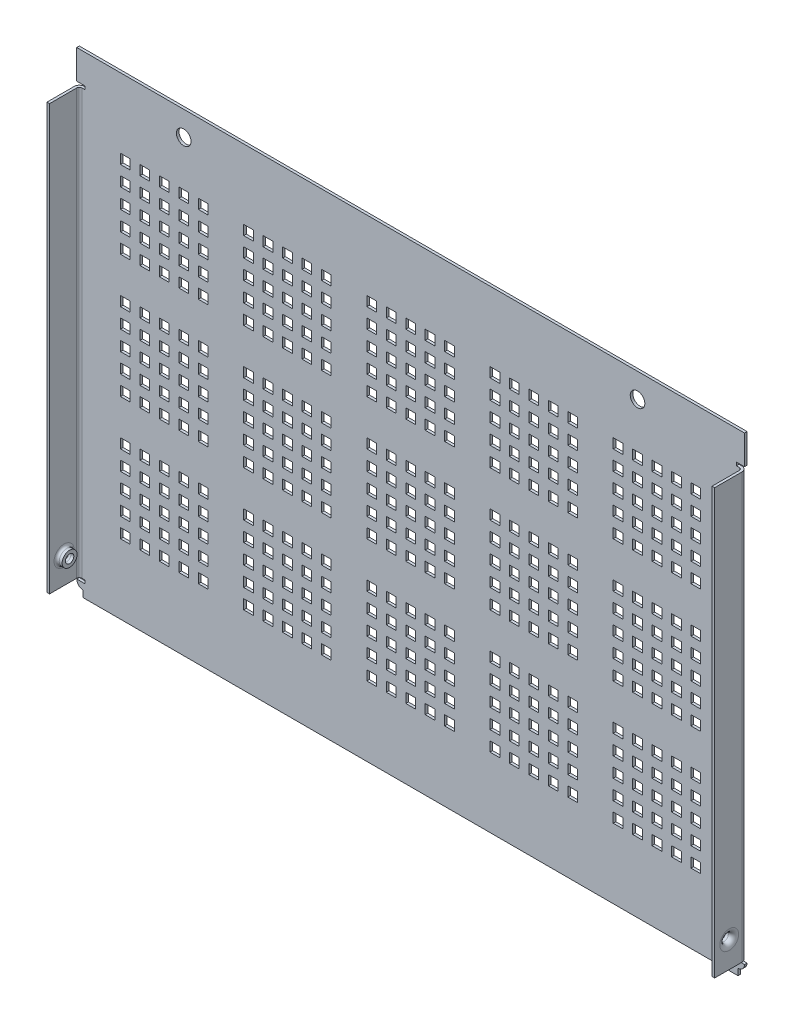
from build123d import *

# Parameters (mm, degrees)
SKETCH_1_R                       = 2.25
EXTRUDE_1_DEPTH                  = 0.8
SKETCH_2_W                       = 0.8
SKETCH_2_H                       = 131
EXTRUDE_2_DEPTH                  = 9.2
SKETCH_3_W                       = 4.088391851
SKETCH_3_H                       = 1
CUT_EXTRUDE_1_DEPTH              = 5
FILLET_1_R                       = 0.8
FILLET_2_R                       = 1.6
SKETCH_4_R                       = 2.3
EXTRUDE_3_DEPTH                  = 2.5
SKETCH_5_R                       = 1.3
CUT_EXTRUDE_2_DEPTH              = 300
FILLET_3_R                       = 1.6
FILLET_4_R                       = 0.8
EXTRUDE_START                    = -2.5
SKETCH_6_R                       = 2.3
SKETCH_6_R_2                     = 1.3
EXTRUDE_4_DEPTH                  = 2.5
FILLET_5_R                       = 0.8
FILLET_6_R                       = 1.6
SKETCH_7_W                       = 3
SKETCH_7_H                       = 3
CUT_EXTRUDE_3_DEPTH              = 10
PATTERN_LINEAR_1_COUNT           = 3
PATTERN_LINEAR_1_PITCH           = 38
PATTERN_LINEAR_3_COUNT           = 3
PATTERN_LINEAR_3_PITCH           = 38
PATTERN_LINEAR_4_COUNT           = 2
PATTERN_LINEAR_4_PITCH           = 38
PATTERN_LINEAR_4_COPY_1_SKETCH_W = 3
PATTERN_LINEAR_4_COPY_1_SKETCH_H = 3
PATTERN_LINEAR_4_COPY_1_DEPTH    = 10
PATTERN_LINEAR_4_COPY_2_SKETCH_W = 3
PATTERN_LINEAR_4_COPY_2_SKETCH_H = 3
PATTERN_LINEAR_4_COPY_2_DEPTH    = 10
PATTERN_LINEAR_4_COPY_3_SKETCH_W = 3
PATTERN_LINEAR_4_COPY_3_SKETCH_H = 3
PATTERN_LINEAR_4_COPY_3_DEPTH    = 10
PATTERN_LINEAR_4_COPY_4_SKETCH_W = 3
PATTERN_LINEAR_4_COPY_4_SKETCH_H = 3
PATTERN_LINEAR_4_COPY_4_DEPTH    = 10
PATTERN_LINEAR_5_COUNT           = 2
PATTERN_LINEAR_5_PITCH           = 38
PATTERN_LINEAR_5_COPY_1_SKETCH_W = 3
PATTERN_LINEAR_5_COPY_1_SKETCH_H = 3
PATTERN_LINEAR_5_COPY_1_DEPTH    = 10
PATTERN_LINEAR_5_COPY_2_SKETCH_W = 3
PATTERN_LINEAR_5_COPY_2_SKETCH_H = 3
PATTERN_LINEAR_5_COPY_2_DEPTH    = 10
PATTERN_LINEAR_5_COPY_3_SKETCH_W = 3
PATTERN_LINEAR_5_COPY_3_SKETCH_H = 3
PATTERN_LINEAR_5_COPY_3_DEPTH    = 10
PATTERN_LINEAR_5_COPY_4_SKETCH_W = 3
PATTERN_LINEAR_5_COPY_4_SKETCH_H = 3
PATTERN_LINEAR_5_COPY_4_DEPTH    = 10


with BuildPart() as part:
    # Эскиз1 → Вытянуть1 (new body)
    with BuildSketch(Plane.XY):
        with BuildLine():
            Line((-101, -73), (101, -73))
            Line((101, -73), (101, -71))
            ThreePointArc((101, -71), (102.414213562, -70.414213562), (103, -69))
            Line((103, -69), (103, 73))
            Line((103, 73), (-103, 73))
            Line((-103, 73), (-103, -69))
            ThreePointArc((-103, -69), (-102.414213562, -70.414213562), (-101, -71))
            Line((-101, -71), (-101, -73))
        make_face()
        with Locations((-70, 65.5)):
            Circle(SKETCH_1_R, mode=Mode.SUBTRACT)
        with Locations((70, 65.5)):
            Circle(SKETCH_1_R, mode=Mode.SUBTRACT)
    extrude(amount=EXTRUDE_1_DEPTH)

    # Эскиз2 → Вытянуть2 (add)
    with BuildSketch(Plane.XY.offset(0.8)):
        with Locations((-102.6, -2.5)):
            Rectangle(SKETCH_2_W, SKETCH_2_H)
        with Locations((102.6, -2.5)):
            Rectangle(SKETCH_2_W, SKETCH_2_H)
    extrude(amount=EXTRUDE_2_DEPTH)

    # Эскиз3 → Вырез-Вытянуть1 (cut)
    with BuildSketch(Plane.XY.offset(0.8)):
        with Locations((-102.544195926, 63.5)):
            Rectangle(SKETCH_3_W, SKETCH_3_H)
        with Locations((-102.544195926, -68.5)):
            Rectangle(SKETCH_3_W, SKETCH_3_H)
        with Locations((102.544195926, -68.5)):
            Rectangle(SKETCH_3_W, SKETCH_3_H)
        with Locations((102.544195926, 63.5)):
            Rectangle(SKETCH_3_W, SKETCH_3_H)
    extrude(amount=-CUT_EXTRUDE_1_DEPTH, mode=Mode.SUBTRACT)

    # Скругление1
    fillet_1_edges = [part.edges().sort_by_distance(p)[0] for p in [
        (102.2, -2.5, 0.8),
        (-102.2, -2.5, 0.8),
    ]]
    fillet(fillet_1_edges, radius=FILLET_1_R)

    # Скругление2
    fillet_2_edges = [part.edges().sort_by_distance(p)[0] for p in [
        (-103, -2.5, 0),
        (103, -2.5, 0),
    ]]
    fillet(fillet_2_edges, radius=FILLET_2_R)

    # Эскиз4 → Вытянуть3 (add)
    with BuildSketch(Plane.ZY.offset(103)):
        with Locations(Location((5.5, -60, 0), (0, 0, 270))):
            Circle(SKETCH_4_R)
    extrude(amount=-EXTRUDE_3_DEPTH)

    # Эскиз5 → Вырез-Вытянуть2 (cut)
    with BuildSketch(Plane.ZY.offset(103)):
        with Locations(Location((5.5, -60, 0), (0, 0, 270))):
            Circle(SKETCH_5_R)
    extrude(amount=-CUT_EXTRUDE_2_DEPTH, mode=Mode.SUBTRACT)

    # Скругление3
    fillet_3_edges = [part.edges().sort_by_distance(p)[0] for p in [
        (-103, -58.7, 5.5),
    ]]
    fillet(fillet_3_edges, radius=FILLET_3_R)

    # Скругление4
    fillet_4_edges = [part.edges().sort_by_distance(p)[0] for p in [
        (-102.2, -57.7, 5.5),
    ]]
    fillet(fillet_4_edges, radius=FILLET_4_R)

    # Эскиз6 → Вытянуть4 (add)
    with BuildSketch(Plane(origin=(103, 0, 0), x_dir=(0, 0, -1), z_dir=(1, 0, 0)).offset(EXTRUDE_START)):
        with Locations(Location((-5.5, -60, 0), (0, 0, 270))):
            Circle(SKETCH_6_R)
        with Locations(Location((-5.5, -60, 0), (0, 0, 270))):
            Circle(SKETCH_6_R_2, mode=Mode.SUBTRACT)
    extrude(amount=EXTRUDE_4_DEPTH)

    # Скругление5
    fillet_5_edges = [part.edges().sort_by_distance(p)[0] for p in [
        (102.2, -57.7, 5.5),
    ]]
    fillet(fillet_5_edges, radius=FILLET_5_R)

    # Скругление6
    fillet_6_edges = [part.edges().sort_by_distance(p)[0] for p in [
        (103, -58.7, 5.5),
    ]]
    fillet(fillet_6_edges, radius=FILLET_6_R)

    # Эскиз7 → Вырез-Вытянуть3 (cut)
    with BuildSketch(Plane(origin=(0, 0, 0), x_dir=(-1, 0, 0), z_dir=(0, 0, -1))):
        with Locations((6, 0)):
            Rectangle(SKETCH_7_W, SKETCH_7_H)
        Rectangle(SKETCH_7_W, SKETCH_7_H)
        with Locations((12, 0)):
            Rectangle(SKETCH_7_W, SKETCH_7_H)
        with Locations((-6, 0)):
            Rectangle(SKETCH_7_W, SKETCH_7_H)
        with Locations((-12, 0)):
            Rectangle(SKETCH_7_W, SKETCH_7_H)
        with Locations((6, 6)):
            Rectangle(SKETCH_7_W, SKETCH_7_H)
        with Locations((0, 6)):
            Rectangle(SKETCH_7_W, SKETCH_7_H)
        with Locations((12, 6)):
            Rectangle(SKETCH_7_W, SKETCH_7_H)
        with Locations((-6, 6)):
            Rectangle(SKETCH_7_W, SKETCH_7_H)
        with Locations((-12, 6)):
            Rectangle(SKETCH_7_W, SKETCH_7_H)
        with Locations((6, 12)):
            Rectangle(SKETCH_7_W, SKETCH_7_H)
        with Locations((0, 12)):
            Rectangle(SKETCH_7_W, SKETCH_7_H)
        with Locations((12, 12)):
            Rectangle(SKETCH_7_W, SKETCH_7_H)
        with Locations((-6, 12)):
            Rectangle(SKETCH_7_W, SKETCH_7_H)
        with Locations((-12, 12)):
            Rectangle(SKETCH_7_W, SKETCH_7_H)
        with Locations((6, -6)):
            Rectangle(SKETCH_7_W, SKETCH_7_H)
        with Locations((0, -6)):
            Rectangle(SKETCH_7_W, SKETCH_7_H)
        with Locations((12, -6)):
            Rectangle(SKETCH_7_W, SKETCH_7_H)
        with Locations((-6, -6)):
            Rectangle(SKETCH_7_W, SKETCH_7_H)
        with Locations((-12, -6)):
            Rectangle(SKETCH_7_W, SKETCH_7_H)
        with Locations((6, -12)):
            Rectangle(SKETCH_7_W, SKETCH_7_H)
        with Locations((0, -12)):
            Rectangle(SKETCH_7_W, SKETCH_7_H)
        with Locations((12, -12)):
            Rectangle(SKETCH_7_W, SKETCH_7_H)
        with Locations((-6, -12)):
            Rectangle(SKETCH_7_W, SKETCH_7_H)
        with Locations((-12, -12)):
            Rectangle(SKETCH_7_W, SKETCH_7_H)
    cut_extrude_3 = extrude(amount=-CUT_EXTRUDE_3_DEPTH, mode=Mode.SUBTRACT)

    # Линейный массив1: Вырез-Вытянуть3 ×3
    with Locations(*[(-i * PATTERN_LINEAR_1_PITCH, 0, 0) for i in range(1, PATTERN_LINEAR_1_COUNT)]):
        add(cut_extrude_3, mode=Mode.SUBTRACT)

    # Линейный массив3: Вырез-Вытянуть3 ×3
    with Locations(*[(i * PATTERN_LINEAR_3_PITCH, 0, 0) for i in range(1, PATTERN_LINEAR_3_COUNT)]):
        add(cut_extrude_3, mode=Mode.SUBTRACT)

    # Линейный массив4: Вырез-Вытянуть3 ×2
    with Locations(*[(0, i * PATTERN_LINEAR_4_PITCH, 0) for i in range(1, PATTERN_LINEAR_4_COUNT)]):
        add(cut_extrude_3, mode=Mode.SUBTRACT)

    # Линейный массив4 copy 1 sketch → Линейный массив4 copy 1 (cut)
    with BuildSketch(Plane(origin=(-38, 38, 0), x_dir=(-1, 0, 0), z_dir=(0, 0, -1))):
        with Locations((6, 0)):
            Rectangle(PATTERN_LINEAR_4_COPY_1_SKETCH_W, PATTERN_LINEAR_4_COPY_1_SKETCH_H)
        Rectangle(PATTERN_LINEAR_4_COPY_1_SKETCH_W, PATTERN_LINEAR_4_COPY_1_SKETCH_H)
        with Locations((12, 0)):
            Rectangle(PATTERN_LINEAR_4_COPY_1_SKETCH_W, PATTERN_LINEAR_4_COPY_1_SKETCH_H)
        with Locations((-6, 0)):
            Rectangle(PATTERN_LINEAR_4_COPY_1_SKETCH_W, PATTERN_LINEAR_4_COPY_1_SKETCH_H)
        with Locations((-12, 0)):
            Rectangle(PATTERN_LINEAR_4_COPY_1_SKETCH_W, PATTERN_LINEAR_4_COPY_1_SKETCH_H)
        with Locations((6, 6)):
            Rectangle(PATTERN_LINEAR_4_COPY_1_SKETCH_W, PATTERN_LINEAR_4_COPY_1_SKETCH_H)
        with Locations((0, 6)):
            Rectangle(PATTERN_LINEAR_4_COPY_1_SKETCH_W, PATTERN_LINEAR_4_COPY_1_SKETCH_H)
        with Locations((12, 6)):
            Rectangle(PATTERN_LINEAR_4_COPY_1_SKETCH_W, PATTERN_LINEAR_4_COPY_1_SKETCH_H)
        with Locations((-6, 6)):
            Rectangle(PATTERN_LINEAR_4_COPY_1_SKETCH_W, PATTERN_LINEAR_4_COPY_1_SKETCH_H)
        with Locations((-12, 6)):
            Rectangle(PATTERN_LINEAR_4_COPY_1_SKETCH_W, PATTERN_LINEAR_4_COPY_1_SKETCH_H)
        with Locations((6, 12)):
            Rectangle(PATTERN_LINEAR_4_COPY_1_SKETCH_W, PATTERN_LINEAR_4_COPY_1_SKETCH_H)
        with Locations((0, 12)):
            Rectangle(PATTERN_LINEAR_4_COPY_1_SKETCH_W, PATTERN_LINEAR_4_COPY_1_SKETCH_H)
        with Locations((12, 12)):
            Rectangle(PATTERN_LINEAR_4_COPY_1_SKETCH_W, PATTERN_LINEAR_4_COPY_1_SKETCH_H)
        with Locations((-6, 12)):
            Rectangle(PATTERN_LINEAR_4_COPY_1_SKETCH_W, PATTERN_LINEAR_4_COPY_1_SKETCH_H)
        with Locations((-12, 12)):
            Rectangle(PATTERN_LINEAR_4_COPY_1_SKETCH_W, PATTERN_LINEAR_4_COPY_1_SKETCH_H)
        with Locations((6, -6)):
            Rectangle(PATTERN_LINEAR_4_COPY_1_SKETCH_W, PATTERN_LINEAR_4_COPY_1_SKETCH_H)
        with Locations((0, -6)):
            Rectangle(PATTERN_LINEAR_4_COPY_1_SKETCH_W, PATTERN_LINEAR_4_COPY_1_SKETCH_H)
        with Locations((12, -6)):
            Rectangle(PATTERN_LINEAR_4_COPY_1_SKETCH_W, PATTERN_LINEAR_4_COPY_1_SKETCH_H)
        with Locations((-6, -6)):
            Rectangle(PATTERN_LINEAR_4_COPY_1_SKETCH_W, PATTERN_LINEAR_4_COPY_1_SKETCH_H)
        with Locations((-12, -6)):
            Rectangle(PATTERN_LINEAR_4_COPY_1_SKETCH_W, PATTERN_LINEAR_4_COPY_1_SKETCH_H)
        with Locations((6, -12)):
            Rectangle(PATTERN_LINEAR_4_COPY_1_SKETCH_W, PATTERN_LINEAR_4_COPY_1_SKETCH_H)
        with Locations((0, -12)):
            Rectangle(PATTERN_LINEAR_4_COPY_1_SKETCH_W, PATTERN_LINEAR_4_COPY_1_SKETCH_H)
        with Locations((12, -12)):
            Rectangle(PATTERN_LINEAR_4_COPY_1_SKETCH_W, PATTERN_LINEAR_4_COPY_1_SKETCH_H)
        with Locations((-6, -12)):
            Rectangle(PATTERN_LINEAR_4_COPY_1_SKETCH_W, PATTERN_LINEAR_4_COPY_1_SKETCH_H)
        with Locations((-12, -12)):
            Rectangle(PATTERN_LINEAR_4_COPY_1_SKETCH_W, PATTERN_LINEAR_4_COPY_1_SKETCH_H)
    extrude(amount=-PATTERN_LINEAR_4_COPY_1_DEPTH, mode=Mode.SUBTRACT)

    # Линейный массив4 copy 2 sketch → Линейный массив4 copy 2 (cut)
    with BuildSketch(Plane(origin=(-76, 38, 0), x_dir=(-1, 0, 0), z_dir=(0, 0, -1))):
        with Locations((6, 0)):
            Rectangle(PATTERN_LINEAR_4_COPY_2_SKETCH_W, PATTERN_LINEAR_4_COPY_2_SKETCH_H)
        Rectangle(PATTERN_LINEAR_4_COPY_2_SKETCH_W, PATTERN_LINEAR_4_COPY_2_SKETCH_H)
        with Locations((12, 0)):
            Rectangle(PATTERN_LINEAR_4_COPY_2_SKETCH_W, PATTERN_LINEAR_4_COPY_2_SKETCH_H)
        with Locations((-6, 0)):
            Rectangle(PATTERN_LINEAR_4_COPY_2_SKETCH_W, PATTERN_LINEAR_4_COPY_2_SKETCH_H)
        with Locations((-12, 0)):
            Rectangle(PATTERN_LINEAR_4_COPY_2_SKETCH_W, PATTERN_LINEAR_4_COPY_2_SKETCH_H)
        with Locations((6, 6)):
            Rectangle(PATTERN_LINEAR_4_COPY_2_SKETCH_W, PATTERN_LINEAR_4_COPY_2_SKETCH_H)
        with Locations((0, 6)):
            Rectangle(PATTERN_LINEAR_4_COPY_2_SKETCH_W, PATTERN_LINEAR_4_COPY_2_SKETCH_H)
        with Locations((12, 6)):
            Rectangle(PATTERN_LINEAR_4_COPY_2_SKETCH_W, PATTERN_LINEAR_4_COPY_2_SKETCH_H)
        with Locations((-6, 6)):
            Rectangle(PATTERN_LINEAR_4_COPY_2_SKETCH_W, PATTERN_LINEAR_4_COPY_2_SKETCH_H)
        with Locations((-12, 6)):
            Rectangle(PATTERN_LINEAR_4_COPY_2_SKETCH_W, PATTERN_LINEAR_4_COPY_2_SKETCH_H)
        with Locations((6, 12)):
            Rectangle(PATTERN_LINEAR_4_COPY_2_SKETCH_W, PATTERN_LINEAR_4_COPY_2_SKETCH_H)
        with Locations((0, 12)):
            Rectangle(PATTERN_LINEAR_4_COPY_2_SKETCH_W, PATTERN_LINEAR_4_COPY_2_SKETCH_H)
        with Locations((12, 12)):
            Rectangle(PATTERN_LINEAR_4_COPY_2_SKETCH_W, PATTERN_LINEAR_4_COPY_2_SKETCH_H)
        with Locations((-6, 12)):
            Rectangle(PATTERN_LINEAR_4_COPY_2_SKETCH_W, PATTERN_LINEAR_4_COPY_2_SKETCH_H)
        with Locations((-12, 12)):
            Rectangle(PATTERN_LINEAR_4_COPY_2_SKETCH_W, PATTERN_LINEAR_4_COPY_2_SKETCH_H)
        with Locations((6, -6)):
            Rectangle(PATTERN_LINEAR_4_COPY_2_SKETCH_W, PATTERN_LINEAR_4_COPY_2_SKETCH_H)
        with Locations((0, -6)):
            Rectangle(PATTERN_LINEAR_4_COPY_2_SKETCH_W, PATTERN_LINEAR_4_COPY_2_SKETCH_H)
        with Locations((12, -6)):
            Rectangle(PATTERN_LINEAR_4_COPY_2_SKETCH_W, PATTERN_LINEAR_4_COPY_2_SKETCH_H)
        with Locations((-6, -6)):
            Rectangle(PATTERN_LINEAR_4_COPY_2_SKETCH_W, PATTERN_LINEAR_4_COPY_2_SKETCH_H)
        with Locations((-12, -6)):
            Rectangle(PATTERN_LINEAR_4_COPY_2_SKETCH_W, PATTERN_LINEAR_4_COPY_2_SKETCH_H)
        with Locations((6, -12)):
            Rectangle(PATTERN_LINEAR_4_COPY_2_SKETCH_W, PATTERN_LINEAR_4_COPY_2_SKETCH_H)
        with Locations((0, -12)):
            Rectangle(PATTERN_LINEAR_4_COPY_2_SKETCH_W, PATTERN_LINEAR_4_COPY_2_SKETCH_H)
        with Locations((12, -12)):
            Rectangle(PATTERN_LINEAR_4_COPY_2_SKETCH_W, PATTERN_LINEAR_4_COPY_2_SKETCH_H)
        with Locations((-6, -12)):
            Rectangle(PATTERN_LINEAR_4_COPY_2_SKETCH_W, PATTERN_LINEAR_4_COPY_2_SKETCH_H)
        with Locations((-12, -12)):
            Rectangle(PATTERN_LINEAR_4_COPY_2_SKETCH_W, PATTERN_LINEAR_4_COPY_2_SKETCH_H)
    extrude(amount=-PATTERN_LINEAR_4_COPY_2_DEPTH, mode=Mode.SUBTRACT)

    # Линейный массив4 copy 3 sketch → Линейный массив4 copy 3 (cut)
    with BuildSketch(Plane(origin=(38, 38, 0), x_dir=(-1, 0, 0), z_dir=(0, 0, -1))):
        with Locations((6, 0)):
            Rectangle(PATTERN_LINEAR_4_COPY_3_SKETCH_W, PATTERN_LINEAR_4_COPY_3_SKETCH_H)
        Rectangle(PATTERN_LINEAR_4_COPY_3_SKETCH_W, PATTERN_LINEAR_4_COPY_3_SKETCH_H)
        with Locations((12, 0)):
            Rectangle(PATTERN_LINEAR_4_COPY_3_SKETCH_W, PATTERN_LINEAR_4_COPY_3_SKETCH_H)
        with Locations((-6, 0)):
            Rectangle(PATTERN_LINEAR_4_COPY_3_SKETCH_W, PATTERN_LINEAR_4_COPY_3_SKETCH_H)
        with Locations((-12, 0)):
            Rectangle(PATTERN_LINEAR_4_COPY_3_SKETCH_W, PATTERN_LINEAR_4_COPY_3_SKETCH_H)
        with Locations((6, 6)):
            Rectangle(PATTERN_LINEAR_4_COPY_3_SKETCH_W, PATTERN_LINEAR_4_COPY_3_SKETCH_H)
        with Locations((0, 6)):
            Rectangle(PATTERN_LINEAR_4_COPY_3_SKETCH_W, PATTERN_LINEAR_4_COPY_3_SKETCH_H)
        with Locations((12, 6)):
            Rectangle(PATTERN_LINEAR_4_COPY_3_SKETCH_W, PATTERN_LINEAR_4_COPY_3_SKETCH_H)
        with Locations((-6, 6)):
            Rectangle(PATTERN_LINEAR_4_COPY_3_SKETCH_W, PATTERN_LINEAR_4_COPY_3_SKETCH_H)
        with Locations((-12, 6)):
            Rectangle(PATTERN_LINEAR_4_COPY_3_SKETCH_W, PATTERN_LINEAR_4_COPY_3_SKETCH_H)
        with Locations((6, 12)):
            Rectangle(PATTERN_LINEAR_4_COPY_3_SKETCH_W, PATTERN_LINEAR_4_COPY_3_SKETCH_H)
        with Locations((0, 12)):
            Rectangle(PATTERN_LINEAR_4_COPY_3_SKETCH_W, PATTERN_LINEAR_4_COPY_3_SKETCH_H)
        with Locations((12, 12)):
            Rectangle(PATTERN_LINEAR_4_COPY_3_SKETCH_W, PATTERN_LINEAR_4_COPY_3_SKETCH_H)
        with Locations((-6, 12)):
            Rectangle(PATTERN_LINEAR_4_COPY_3_SKETCH_W, PATTERN_LINEAR_4_COPY_3_SKETCH_H)
        with Locations((-12, 12)):
            Rectangle(PATTERN_LINEAR_4_COPY_3_SKETCH_W, PATTERN_LINEAR_4_COPY_3_SKETCH_H)
        with Locations((6, -6)):
            Rectangle(PATTERN_LINEAR_4_COPY_3_SKETCH_W, PATTERN_LINEAR_4_COPY_3_SKETCH_H)
        with Locations((0, -6)):
            Rectangle(PATTERN_LINEAR_4_COPY_3_SKETCH_W, PATTERN_LINEAR_4_COPY_3_SKETCH_H)
        with Locations((12, -6)):
            Rectangle(PATTERN_LINEAR_4_COPY_3_SKETCH_W, PATTERN_LINEAR_4_COPY_3_SKETCH_H)
        with Locations((-6, -6)):
            Rectangle(PATTERN_LINEAR_4_COPY_3_SKETCH_W, PATTERN_LINEAR_4_COPY_3_SKETCH_H)
        with Locations((-12, -6)):
            Rectangle(PATTERN_LINEAR_4_COPY_3_SKETCH_W, PATTERN_LINEAR_4_COPY_3_SKETCH_H)
        with Locations((6, -12)):
            Rectangle(PATTERN_LINEAR_4_COPY_3_SKETCH_W, PATTERN_LINEAR_4_COPY_3_SKETCH_H)
        with Locations((0, -12)):
            Rectangle(PATTERN_LINEAR_4_COPY_3_SKETCH_W, PATTERN_LINEAR_4_COPY_3_SKETCH_H)
        with Locations((12, -12)):
            Rectangle(PATTERN_LINEAR_4_COPY_3_SKETCH_W, PATTERN_LINEAR_4_COPY_3_SKETCH_H)
        with Locations((-6, -12)):
            Rectangle(PATTERN_LINEAR_4_COPY_3_SKETCH_W, PATTERN_LINEAR_4_COPY_3_SKETCH_H)
        with Locations((-12, -12)):
            Rectangle(PATTERN_LINEAR_4_COPY_3_SKETCH_W, PATTERN_LINEAR_4_COPY_3_SKETCH_H)
    extrude(amount=-PATTERN_LINEAR_4_COPY_3_DEPTH, mode=Mode.SUBTRACT)

    # Линейный массив4 copy 4 sketch → Линейный массив4 copy 4 (cut)
    with BuildSketch(Plane(origin=(76, 38, 0), x_dir=(-1, 0, 0), z_dir=(0, 0, -1))):
        with Locations((6, 0)):
            Rectangle(PATTERN_LINEAR_4_COPY_4_SKETCH_W, PATTERN_LINEAR_4_COPY_4_SKETCH_H)
        Rectangle(PATTERN_LINEAR_4_COPY_4_SKETCH_W, PATTERN_LINEAR_4_COPY_4_SKETCH_H)
        with Locations((12, 0)):
            Rectangle(PATTERN_LINEAR_4_COPY_4_SKETCH_W, PATTERN_LINEAR_4_COPY_4_SKETCH_H)
        with Locations((-6, 0)):
            Rectangle(PATTERN_LINEAR_4_COPY_4_SKETCH_W, PATTERN_LINEAR_4_COPY_4_SKETCH_H)
        with Locations((-12, 0)):
            Rectangle(PATTERN_LINEAR_4_COPY_4_SKETCH_W, PATTERN_LINEAR_4_COPY_4_SKETCH_H)
        with Locations((6, 6)):
            Rectangle(PATTERN_LINEAR_4_COPY_4_SKETCH_W, PATTERN_LINEAR_4_COPY_4_SKETCH_H)
        with Locations((0, 6)):
            Rectangle(PATTERN_LINEAR_4_COPY_4_SKETCH_W, PATTERN_LINEAR_4_COPY_4_SKETCH_H)
        with Locations((12, 6)):
            Rectangle(PATTERN_LINEAR_4_COPY_4_SKETCH_W, PATTERN_LINEAR_4_COPY_4_SKETCH_H)
        with Locations((-6, 6)):
            Rectangle(PATTERN_LINEAR_4_COPY_4_SKETCH_W, PATTERN_LINEAR_4_COPY_4_SKETCH_H)
        with Locations((-12, 6)):
            Rectangle(PATTERN_LINEAR_4_COPY_4_SKETCH_W, PATTERN_LINEAR_4_COPY_4_SKETCH_H)
        with Locations((6, 12)):
            Rectangle(PATTERN_LINEAR_4_COPY_4_SKETCH_W, PATTERN_LINEAR_4_COPY_4_SKETCH_H)
        with Locations((0, 12)):
            Rectangle(PATTERN_LINEAR_4_COPY_4_SKETCH_W, PATTERN_LINEAR_4_COPY_4_SKETCH_H)
        with Locations((12, 12)):
            Rectangle(PATTERN_LINEAR_4_COPY_4_SKETCH_W, PATTERN_LINEAR_4_COPY_4_SKETCH_H)
        with Locations((-6, 12)):
            Rectangle(PATTERN_LINEAR_4_COPY_4_SKETCH_W, PATTERN_LINEAR_4_COPY_4_SKETCH_H)
        with Locations((-12, 12)):
            Rectangle(PATTERN_LINEAR_4_COPY_4_SKETCH_W, PATTERN_LINEAR_4_COPY_4_SKETCH_H)
        with Locations((6, -6)):
            Rectangle(PATTERN_LINEAR_4_COPY_4_SKETCH_W, PATTERN_LINEAR_4_COPY_4_SKETCH_H)
        with Locations((0, -6)):
            Rectangle(PATTERN_LINEAR_4_COPY_4_SKETCH_W, PATTERN_LINEAR_4_COPY_4_SKETCH_H)
        with Locations((12, -6)):
            Rectangle(PATTERN_LINEAR_4_COPY_4_SKETCH_W, PATTERN_LINEAR_4_COPY_4_SKETCH_H)
        with Locations((-6, -6)):
            Rectangle(PATTERN_LINEAR_4_COPY_4_SKETCH_W, PATTERN_LINEAR_4_COPY_4_SKETCH_H)
        with Locations((-12, -6)):
            Rectangle(PATTERN_LINEAR_4_COPY_4_SKETCH_W, PATTERN_LINEAR_4_COPY_4_SKETCH_H)
        with Locations((6, -12)):
            Rectangle(PATTERN_LINEAR_4_COPY_4_SKETCH_W, PATTERN_LINEAR_4_COPY_4_SKETCH_H)
        with Locations((0, -12)):
            Rectangle(PATTERN_LINEAR_4_COPY_4_SKETCH_W, PATTERN_LINEAR_4_COPY_4_SKETCH_H)
        with Locations((12, -12)):
            Rectangle(PATTERN_LINEAR_4_COPY_4_SKETCH_W, PATTERN_LINEAR_4_COPY_4_SKETCH_H)
        with Locations((-6, -12)):
            Rectangle(PATTERN_LINEAR_4_COPY_4_SKETCH_W, PATTERN_LINEAR_4_COPY_4_SKETCH_H)
        with Locations((-12, -12)):
            Rectangle(PATTERN_LINEAR_4_COPY_4_SKETCH_W, PATTERN_LINEAR_4_COPY_4_SKETCH_H)
    extrude(amount=-PATTERN_LINEAR_4_COPY_4_DEPTH, mode=Mode.SUBTRACT)

    # Линейный массив5: Вырез-Вытянуть3 ×2
    with Locations(*[(0, -i * PATTERN_LINEAR_5_PITCH, 0) for i in range(1, PATTERN_LINEAR_5_COUNT)]):
        add(cut_extrude_3, mode=Mode.SUBTRACT)

    # Линейный массив5 copy 1 sketch → Линейный массив5 copy 1 (cut)
    with BuildSketch(Plane(origin=(-38, -38, 0), x_dir=(-1, 0, 0), z_dir=(0, 0, -1))):
        with Locations((6, 0)):
            Rectangle(PATTERN_LINEAR_5_COPY_1_SKETCH_W, PATTERN_LINEAR_5_COPY_1_SKETCH_H)
        Rectangle(PATTERN_LINEAR_5_COPY_1_SKETCH_W, PATTERN_LINEAR_5_COPY_1_SKETCH_H)
        with Locations((12, 0)):
            Rectangle(PATTERN_LINEAR_5_COPY_1_SKETCH_W, PATTERN_LINEAR_5_COPY_1_SKETCH_H)
        with Locations((-6, 0)):
            Rectangle(PATTERN_LINEAR_5_COPY_1_SKETCH_W, PATTERN_LINEAR_5_COPY_1_SKETCH_H)
        with Locations((-12, 0)):
            Rectangle(PATTERN_LINEAR_5_COPY_1_SKETCH_W, PATTERN_LINEAR_5_COPY_1_SKETCH_H)
        with Locations((6, 6)):
            Rectangle(PATTERN_LINEAR_5_COPY_1_SKETCH_W, PATTERN_LINEAR_5_COPY_1_SKETCH_H)
        with Locations((0, 6)):
            Rectangle(PATTERN_LINEAR_5_COPY_1_SKETCH_W, PATTERN_LINEAR_5_COPY_1_SKETCH_H)
        with Locations((12, 6)):
            Rectangle(PATTERN_LINEAR_5_COPY_1_SKETCH_W, PATTERN_LINEAR_5_COPY_1_SKETCH_H)
        with Locations((-6, 6)):
            Rectangle(PATTERN_LINEAR_5_COPY_1_SKETCH_W, PATTERN_LINEAR_5_COPY_1_SKETCH_H)
        with Locations((-12, 6)):
            Rectangle(PATTERN_LINEAR_5_COPY_1_SKETCH_W, PATTERN_LINEAR_5_COPY_1_SKETCH_H)
        with Locations((6, 12)):
            Rectangle(PATTERN_LINEAR_5_COPY_1_SKETCH_W, PATTERN_LINEAR_5_COPY_1_SKETCH_H)
        with Locations((0, 12)):
            Rectangle(PATTERN_LINEAR_5_COPY_1_SKETCH_W, PATTERN_LINEAR_5_COPY_1_SKETCH_H)
        with Locations((12, 12)):
            Rectangle(PATTERN_LINEAR_5_COPY_1_SKETCH_W, PATTERN_LINEAR_5_COPY_1_SKETCH_H)
        with Locations((-6, 12)):
            Rectangle(PATTERN_LINEAR_5_COPY_1_SKETCH_W, PATTERN_LINEAR_5_COPY_1_SKETCH_H)
        with Locations((-12, 12)):
            Rectangle(PATTERN_LINEAR_5_COPY_1_SKETCH_W, PATTERN_LINEAR_5_COPY_1_SKETCH_H)
        with Locations((6, -6)):
            Rectangle(PATTERN_LINEAR_5_COPY_1_SKETCH_W, PATTERN_LINEAR_5_COPY_1_SKETCH_H)
        with Locations((0, -6)):
            Rectangle(PATTERN_LINEAR_5_COPY_1_SKETCH_W, PATTERN_LINEAR_5_COPY_1_SKETCH_H)
        with Locations((12, -6)):
            Rectangle(PATTERN_LINEAR_5_COPY_1_SKETCH_W, PATTERN_LINEAR_5_COPY_1_SKETCH_H)
        with Locations((-6, -6)):
            Rectangle(PATTERN_LINEAR_5_COPY_1_SKETCH_W, PATTERN_LINEAR_5_COPY_1_SKETCH_H)
        with Locations((-12, -6)):
            Rectangle(PATTERN_LINEAR_5_COPY_1_SKETCH_W, PATTERN_LINEAR_5_COPY_1_SKETCH_H)
        with Locations((6, -12)):
            Rectangle(PATTERN_LINEAR_5_COPY_1_SKETCH_W, PATTERN_LINEAR_5_COPY_1_SKETCH_H)
        with Locations((0, -12)):
            Rectangle(PATTERN_LINEAR_5_COPY_1_SKETCH_W, PATTERN_LINEAR_5_COPY_1_SKETCH_H)
        with Locations((12, -12)):
            Rectangle(PATTERN_LINEAR_5_COPY_1_SKETCH_W, PATTERN_LINEAR_5_COPY_1_SKETCH_H)
        with Locations((-6, -12)):
            Rectangle(PATTERN_LINEAR_5_COPY_1_SKETCH_W, PATTERN_LINEAR_5_COPY_1_SKETCH_H)
        with Locations((-12, -12)):
            Rectangle(PATTERN_LINEAR_5_COPY_1_SKETCH_W, PATTERN_LINEAR_5_COPY_1_SKETCH_H)
    extrude(amount=-PATTERN_LINEAR_5_COPY_1_DEPTH, mode=Mode.SUBTRACT)

    # Линейный массив5 copy 2 sketch → Линейный массив5 copy 2 (cut)
    with BuildSketch(Plane(origin=(-76, -38, 0), x_dir=(-1, 0, 0), z_dir=(0, 0, -1))):
        with Locations((6, 0)):
            Rectangle(PATTERN_LINEAR_5_COPY_2_SKETCH_W, PATTERN_LINEAR_5_COPY_2_SKETCH_H)
        Rectangle(PATTERN_LINEAR_5_COPY_2_SKETCH_W, PATTERN_LINEAR_5_COPY_2_SKETCH_H)
        with Locations((12, 0)):
            Rectangle(PATTERN_LINEAR_5_COPY_2_SKETCH_W, PATTERN_LINEAR_5_COPY_2_SKETCH_H)
        with Locations((-6, 0)):
            Rectangle(PATTERN_LINEAR_5_COPY_2_SKETCH_W, PATTERN_LINEAR_5_COPY_2_SKETCH_H)
        with Locations((-12, 0)):
            Rectangle(PATTERN_LINEAR_5_COPY_2_SKETCH_W, PATTERN_LINEAR_5_COPY_2_SKETCH_H)
        with Locations((6, 6)):
            Rectangle(PATTERN_LINEAR_5_COPY_2_SKETCH_W, PATTERN_LINEAR_5_COPY_2_SKETCH_H)
        with Locations((0, 6)):
            Rectangle(PATTERN_LINEAR_5_COPY_2_SKETCH_W, PATTERN_LINEAR_5_COPY_2_SKETCH_H)
        with Locations((12, 6)):
            Rectangle(PATTERN_LINEAR_5_COPY_2_SKETCH_W, PATTERN_LINEAR_5_COPY_2_SKETCH_H)
        with Locations((-6, 6)):
            Rectangle(PATTERN_LINEAR_5_COPY_2_SKETCH_W, PATTERN_LINEAR_5_COPY_2_SKETCH_H)
        with Locations((-12, 6)):
            Rectangle(PATTERN_LINEAR_5_COPY_2_SKETCH_W, PATTERN_LINEAR_5_COPY_2_SKETCH_H)
        with Locations((6, 12)):
            Rectangle(PATTERN_LINEAR_5_COPY_2_SKETCH_W, PATTERN_LINEAR_5_COPY_2_SKETCH_H)
        with Locations((0, 12)):
            Rectangle(PATTERN_LINEAR_5_COPY_2_SKETCH_W, PATTERN_LINEAR_5_COPY_2_SKETCH_H)
        with Locations((12, 12)):
            Rectangle(PATTERN_LINEAR_5_COPY_2_SKETCH_W, PATTERN_LINEAR_5_COPY_2_SKETCH_H)
        with Locations((-6, 12)):
            Rectangle(PATTERN_LINEAR_5_COPY_2_SKETCH_W, PATTERN_LINEAR_5_COPY_2_SKETCH_H)
        with Locations((-12, 12)):
            Rectangle(PATTERN_LINEAR_5_COPY_2_SKETCH_W, PATTERN_LINEAR_5_COPY_2_SKETCH_H)
        with Locations((6, -6)):
            Rectangle(PATTERN_LINEAR_5_COPY_2_SKETCH_W, PATTERN_LINEAR_5_COPY_2_SKETCH_H)
        with Locations((0, -6)):
            Rectangle(PATTERN_LINEAR_5_COPY_2_SKETCH_W, PATTERN_LINEAR_5_COPY_2_SKETCH_H)
        with Locations((12, -6)):
            Rectangle(PATTERN_LINEAR_5_COPY_2_SKETCH_W, PATTERN_LINEAR_5_COPY_2_SKETCH_H)
        with Locations((-6, -6)):
            Rectangle(PATTERN_LINEAR_5_COPY_2_SKETCH_W, PATTERN_LINEAR_5_COPY_2_SKETCH_H)
        with Locations((-12, -6)):
            Rectangle(PATTERN_LINEAR_5_COPY_2_SKETCH_W, PATTERN_LINEAR_5_COPY_2_SKETCH_H)
        with Locations((6, -12)):
            Rectangle(PATTERN_LINEAR_5_COPY_2_SKETCH_W, PATTERN_LINEAR_5_COPY_2_SKETCH_H)
        with Locations((0, -12)):
            Rectangle(PATTERN_LINEAR_5_COPY_2_SKETCH_W, PATTERN_LINEAR_5_COPY_2_SKETCH_H)
        with Locations((12, -12)):
            Rectangle(PATTERN_LINEAR_5_COPY_2_SKETCH_W, PATTERN_LINEAR_5_COPY_2_SKETCH_H)
        with Locations((-6, -12)):
            Rectangle(PATTERN_LINEAR_5_COPY_2_SKETCH_W, PATTERN_LINEAR_5_COPY_2_SKETCH_H)
        with Locations((-12, -12)):
            Rectangle(PATTERN_LINEAR_5_COPY_2_SKETCH_W, PATTERN_LINEAR_5_COPY_2_SKETCH_H)
    extrude(amount=-PATTERN_LINEAR_5_COPY_2_DEPTH, mode=Mode.SUBTRACT)

    # Линейный массив5 copy 3 sketch → Линейный массив5 copy 3 (cut)
    with BuildSketch(Plane(origin=(38, -38, 0), x_dir=(-1, 0, 0), z_dir=(0, 0, -1))):
        with Locations((6, 0)):
            Rectangle(PATTERN_LINEAR_5_COPY_3_SKETCH_W, PATTERN_LINEAR_5_COPY_3_SKETCH_H)
        Rectangle(PATTERN_LINEAR_5_COPY_3_SKETCH_W, PATTERN_LINEAR_5_COPY_3_SKETCH_H)
        with Locations((12, 0)):
            Rectangle(PATTERN_LINEAR_5_COPY_3_SKETCH_W, PATTERN_LINEAR_5_COPY_3_SKETCH_H)
        with Locations((-6, 0)):
            Rectangle(PATTERN_LINEAR_5_COPY_3_SKETCH_W, PATTERN_LINEAR_5_COPY_3_SKETCH_H)
        with Locations((-12, 0)):
            Rectangle(PATTERN_LINEAR_5_COPY_3_SKETCH_W, PATTERN_LINEAR_5_COPY_3_SKETCH_H)
        with Locations((6, 6)):
            Rectangle(PATTERN_LINEAR_5_COPY_3_SKETCH_W, PATTERN_LINEAR_5_COPY_3_SKETCH_H)
        with Locations((0, 6)):
            Rectangle(PATTERN_LINEAR_5_COPY_3_SKETCH_W, PATTERN_LINEAR_5_COPY_3_SKETCH_H)
        with Locations((12, 6)):
            Rectangle(PATTERN_LINEAR_5_COPY_3_SKETCH_W, PATTERN_LINEAR_5_COPY_3_SKETCH_H)
        with Locations((-6, 6)):
            Rectangle(PATTERN_LINEAR_5_COPY_3_SKETCH_W, PATTERN_LINEAR_5_COPY_3_SKETCH_H)
        with Locations((-12, 6)):
            Rectangle(PATTERN_LINEAR_5_COPY_3_SKETCH_W, PATTERN_LINEAR_5_COPY_3_SKETCH_H)
        with Locations((6, 12)):
            Rectangle(PATTERN_LINEAR_5_COPY_3_SKETCH_W, PATTERN_LINEAR_5_COPY_3_SKETCH_H)
        with Locations((0, 12)):
            Rectangle(PATTERN_LINEAR_5_COPY_3_SKETCH_W, PATTERN_LINEAR_5_COPY_3_SKETCH_H)
        with Locations((12, 12)):
            Rectangle(PATTERN_LINEAR_5_COPY_3_SKETCH_W, PATTERN_LINEAR_5_COPY_3_SKETCH_H)
        with Locations((-6, 12)):
            Rectangle(PATTERN_LINEAR_5_COPY_3_SKETCH_W, PATTERN_LINEAR_5_COPY_3_SKETCH_H)
        with Locations((-12, 12)):
            Rectangle(PATTERN_LINEAR_5_COPY_3_SKETCH_W, PATTERN_LINEAR_5_COPY_3_SKETCH_H)
        with Locations((6, -6)):
            Rectangle(PATTERN_LINEAR_5_COPY_3_SKETCH_W, PATTERN_LINEAR_5_COPY_3_SKETCH_H)
        with Locations((0, -6)):
            Rectangle(PATTERN_LINEAR_5_COPY_3_SKETCH_W, PATTERN_LINEAR_5_COPY_3_SKETCH_H)
        with Locations((12, -6)):
            Rectangle(PATTERN_LINEAR_5_COPY_3_SKETCH_W, PATTERN_LINEAR_5_COPY_3_SKETCH_H)
        with Locations((-6, -6)):
            Rectangle(PATTERN_LINEAR_5_COPY_3_SKETCH_W, PATTERN_LINEAR_5_COPY_3_SKETCH_H)
        with Locations((-12, -6)):
            Rectangle(PATTERN_LINEAR_5_COPY_3_SKETCH_W, PATTERN_LINEAR_5_COPY_3_SKETCH_H)
        with Locations((6, -12)):
            Rectangle(PATTERN_LINEAR_5_COPY_3_SKETCH_W, PATTERN_LINEAR_5_COPY_3_SKETCH_H)
        with Locations((0, -12)):
            Rectangle(PATTERN_LINEAR_5_COPY_3_SKETCH_W, PATTERN_LINEAR_5_COPY_3_SKETCH_H)
        with Locations((12, -12)):
            Rectangle(PATTERN_LINEAR_5_COPY_3_SKETCH_W, PATTERN_LINEAR_5_COPY_3_SKETCH_H)
        with Locations((-6, -12)):
            Rectangle(PATTERN_LINEAR_5_COPY_3_SKETCH_W, PATTERN_LINEAR_5_COPY_3_SKETCH_H)
        with Locations((-12, -12)):
            Rectangle(PATTERN_LINEAR_5_COPY_3_SKETCH_W, PATTERN_LINEAR_5_COPY_3_SKETCH_H)
    extrude(amount=-PATTERN_LINEAR_5_COPY_3_DEPTH, mode=Mode.SUBTRACT)

    # Линейный массив5 copy 4 sketch → Линейный массив5 copy 4 (cut)
    with BuildSketch(Plane(origin=(76, -38, 0), x_dir=(-1, 0, 0), z_dir=(0, 0, -1))):
        with Locations((6, 0)):
            Rectangle(PATTERN_LINEAR_5_COPY_4_SKETCH_W, PATTERN_LINEAR_5_COPY_4_SKETCH_H)
        Rectangle(PATTERN_LINEAR_5_COPY_4_SKETCH_W, PATTERN_LINEAR_5_COPY_4_SKETCH_H)
        with Locations((12, 0)):
            Rectangle(PATTERN_LINEAR_5_COPY_4_SKETCH_W, PATTERN_LINEAR_5_COPY_4_SKETCH_H)
        with Locations((-6, 0)):
            Rectangle(PATTERN_LINEAR_5_COPY_4_SKETCH_W, PATTERN_LINEAR_5_COPY_4_SKETCH_H)
        with Locations((-12, 0)):
            Rectangle(PATTERN_LINEAR_5_COPY_4_SKETCH_W, PATTERN_LINEAR_5_COPY_4_SKETCH_H)
        with Locations((6, 6)):
            Rectangle(PATTERN_LINEAR_5_COPY_4_SKETCH_W, PATTERN_LINEAR_5_COPY_4_SKETCH_H)
        with Locations((0, 6)):
            Rectangle(PATTERN_LINEAR_5_COPY_4_SKETCH_W, PATTERN_LINEAR_5_COPY_4_SKETCH_H)
        with Locations((12, 6)):
            Rectangle(PATTERN_LINEAR_5_COPY_4_SKETCH_W, PATTERN_LINEAR_5_COPY_4_SKETCH_H)
        with Locations((-6, 6)):
            Rectangle(PATTERN_LINEAR_5_COPY_4_SKETCH_W, PATTERN_LINEAR_5_COPY_4_SKETCH_H)
        with Locations((-12, 6)):
            Rectangle(PATTERN_LINEAR_5_COPY_4_SKETCH_W, PATTERN_LINEAR_5_COPY_4_SKETCH_H)
        with Locations((6, 12)):
            Rectangle(PATTERN_LINEAR_5_COPY_4_SKETCH_W, PATTERN_LINEAR_5_COPY_4_SKETCH_H)
        with Locations((0, 12)):
            Rectangle(PATTERN_LINEAR_5_COPY_4_SKETCH_W, PATTERN_LINEAR_5_COPY_4_SKETCH_H)
        with Locations((12, 12)):
            Rectangle(PATTERN_LINEAR_5_COPY_4_SKETCH_W, PATTERN_LINEAR_5_COPY_4_SKETCH_H)
        with Locations((-6, 12)):
            Rectangle(PATTERN_LINEAR_5_COPY_4_SKETCH_W, PATTERN_LINEAR_5_COPY_4_SKETCH_H)
        with Locations((-12, 12)):
            Rectangle(PATTERN_LINEAR_5_COPY_4_SKETCH_W, PATTERN_LINEAR_5_COPY_4_SKETCH_H)
        with Locations((6, -6)):
            Rectangle(PATTERN_LINEAR_5_COPY_4_SKETCH_W, PATTERN_LINEAR_5_COPY_4_SKETCH_H)
        with Locations((0, -6)):
            Rectangle(PATTERN_LINEAR_5_COPY_4_SKETCH_W, PATTERN_LINEAR_5_COPY_4_SKETCH_H)
        with Locations((12, -6)):
            Rectangle(PATTERN_LINEAR_5_COPY_4_SKETCH_W, PATTERN_LINEAR_5_COPY_4_SKETCH_H)
        with Locations((-6, -6)):
            Rectangle(PATTERN_LINEAR_5_COPY_4_SKETCH_W, PATTERN_LINEAR_5_COPY_4_SKETCH_H)
        with Locations((-12, -6)):
            Rectangle(PATTERN_LINEAR_5_COPY_4_SKETCH_W, PATTERN_LINEAR_5_COPY_4_SKETCH_H)
        with Locations((6, -12)):
            Rectangle(PATTERN_LINEAR_5_COPY_4_SKETCH_W, PATTERN_LINEAR_5_COPY_4_SKETCH_H)
        with Locations((0, -12)):
            Rectangle(PATTERN_LINEAR_5_COPY_4_SKETCH_W, PATTERN_LINEAR_5_COPY_4_SKETCH_H)
        with Locations((12, -12)):
            Rectangle(PATTERN_LINEAR_5_COPY_4_SKETCH_W, PATTERN_LINEAR_5_COPY_4_SKETCH_H)
        with Locations((-6, -12)):
            Rectangle(PATTERN_LINEAR_5_COPY_4_SKETCH_W, PATTERN_LINEAR_5_COPY_4_SKETCH_H)
        with Locations((-12, -12)):
            Rectangle(PATTERN_LINEAR_5_COPY_4_SKETCH_W, PATTERN_LINEAR_5_COPY_4_SKETCH_H)
    extrude(amount=-PATTERN_LINEAR_5_COPY_4_DEPTH, mode=Mode.SUBTRACT)


solid = part.part
